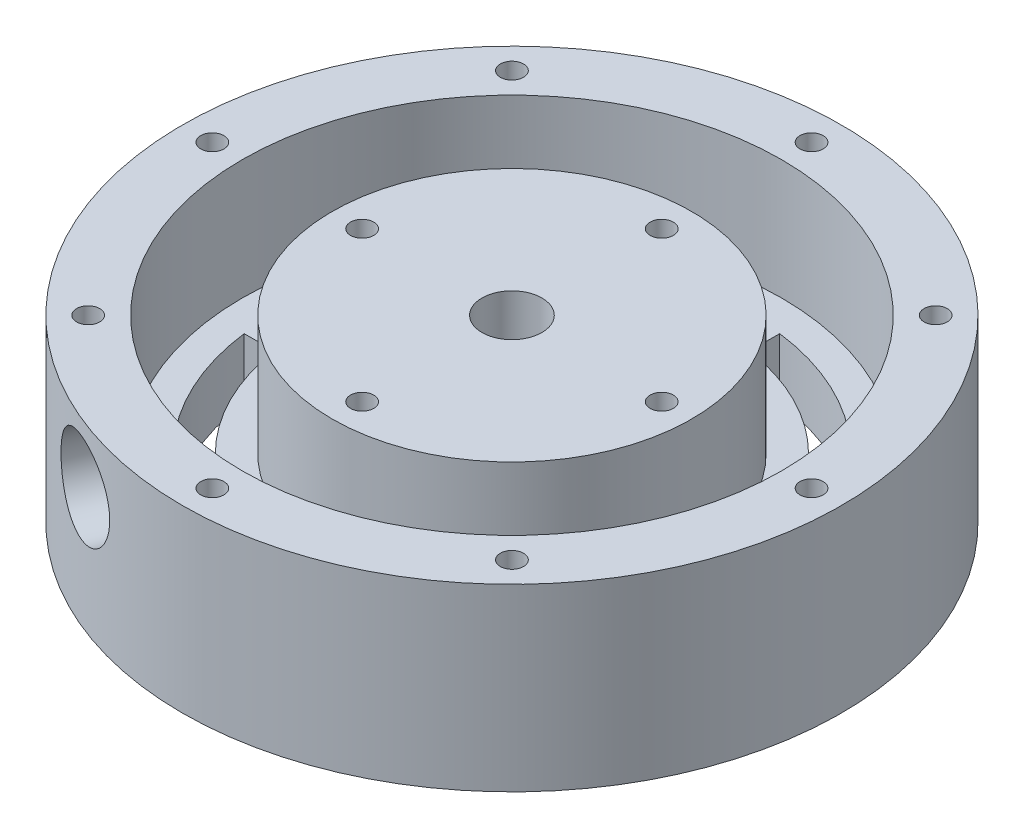
from build123d import *

# Parameters (mm, degrees)
SKETCH2_R                    = 69.85
SKETCH2_R_2                  = 57.15
BOSS_EXTRUDE2_DEPTH          = 25.4
SKETCH2_R_3                  = 38.1
SKETCH2_R_4                  = 6.35
BOSS_EXTRUDE2_2_DEPTH        = 25.4
BOSS_EXTRUDE3_START          = -12.7
SKETCH2_5_R                  = 69.85
SKETCH2_5_R_2                = 6.35
BOSS_EXTRUDE3_DEPTH          = 12.7
F_10_0_1935_DIAMETER_HOLE1_D = 4.9149
CIRPATTERN1_COUNT            = 8
F_10_0_1935_DIAMETER_HOLE2_D = 4.9149
CIRPATTERN2_COUNT            = 4
CUT_EXTRUDE1_REACH           = 169.427
SKETCH6_R                    = 9.525


with BuildPart() as part:
    # Sketch2 → Boss-Extrude2 (new body)
    with BuildSketch(Plane(origin=(0, 0, 0), x_dir=(1, 0, 0), z_dir=(0, 1, 0))):
        Circle(SKETCH2_R)
        Circle(SKETCH2_R_2, mode=Mode.SUBTRACT)
    extrude(amount=BOSS_EXTRUDE2_DEPTH)



with BuildPart() as body_2:
    # Sketch2 → Boss-Extrude2 2 (new body)
    with BuildSketch(Plane(origin=(0, 0, 0), x_dir=(1, 0, 0), z_dir=(0, 1, 0))):
        Circle(SKETCH2_R_3)
        Circle(SKETCH2_R_4, mode=Mode.SUBTRACT)
    extrude(amount=BOSS_EXTRUDE2_2_DEPTH)


with BuildPart() as part_1:
    add(part.part)

    add(body_2.part)  # Boss-Extrude3 merges body 2
    # Sketch2<5> → Boss-Extrude3 (add)
    with BuildSketch(Plane(origin=(0, 0, 0), x_dir=(1, 0, 0), z_dir=(0, 1, 0)).offset(BOSS_EXTRUDE3_START)):
        Circle(SKETCH2_5_R)
        with BuildLine():
            Line((-50.401562476, -6.35), (-43.994090512, -6.35))
            ThreePointArc((-43.994090512, -6.35), (-31.430896424, -31.430896424), (-6.35, -43.994090512))
            Line((-6.35, -43.994090512), (-6.35, -50.401562476))
            ThreePointArc((-6.35, -50.401562476), (-35.921024484, -35.921024484), (-50.401562476, -6.35))
        make_face(mode=Mode.SUBTRACT)
        with BuildLine():
            Line((6.35, -50.401562476), (6.35, -43.994090512))
            ThreePointArc((6.35, -43.994090512), (31.430896424, -31.430896424), (43.994090512, -6.35))
            Line((43.994090512, -6.35), (50.401562476, -6.35))
            ThreePointArc((50.401562476, -6.35), (35.921024484, -35.921024484), (6.35, -50.401562476))
        make_face(mode=Mode.SUBTRACT)
        with BuildLine():
            Line((-6.35, 50.401562476), (-6.35, 43.994090512))
            ThreePointArc((-6.35, 43.994090512), (-31.430896424, 31.430896424), (-43.994090512, 6.35))
            Line((-43.994090512, 6.35), (-50.401562476, 6.35))
            ThreePointArc((-50.401562476, 6.35), (-35.921024484, 35.921024484), (-6.35, 50.401562476))
        make_face(mode=Mode.SUBTRACT)
        with BuildLine():
            Line((50.401562476, 6.35), (43.994090512, 6.35))
            ThreePointArc((43.994090512, 6.35), (31.430896424, 31.430896424), (6.35, 43.994090512))
            Line((6.35, 43.994090512), (6.35, 50.401562476))
            ThreePointArc((6.35, 50.401562476), (35.921024484, 35.921024484), (50.401562476, 6.35))
        make_face(mode=Mode.SUBTRACT)
        Circle(SKETCH2_5_R_2, mode=Mode.SUBTRACT)
    extrude(amount=BOSS_EXTRUDE3_DEPTH)

    # #10 (0.1935) Diameter Hole1 (through all)
    with Locations(Plane(origin=(0, 25.4, 0), x_dir=(1, 0, 0), z_dir=(0, 1, 0))):
        with Locations((0, -63.5)):
            f_10_0_1935_diameter_hole1 = Hole(F_10_0_1935_DIAMETER_HOLE1_D / 2)

    # CirPattern1: #10 (0.1935) Diameter Hole1 ×8 about axis
    cirpattern1_axis = Axis((0, -12.7, 0), (0, 1, 0))
    for i in range(1, CIRPATTERN1_COUNT):
        add(f_10_0_1935_diameter_hole1.rotate(cirpattern1_axis, i * 360 / CIRPATTERN1_COUNT), mode=Mode.SUBTRACT)

    # #10 (0.1935) Diameter Hole2 (through all)
    with Locations(Plane(origin=(0, -12.7, 31.75), x_dir=(0, 0, -1), z_dir=(0, -1, 0))):
        with Locations((0, 0)):
            f_10_0_1935_diameter_hole2 = Hole(F_10_0_1935_DIAMETER_HOLE2_D / 2)

    # CirPattern2: #10 (0.1935) Diameter Hole2 ×4 about axis
    cirpattern2_axis = Axis((0, -12.7, 0), (0, 1, 0))
    for i in range(1, CIRPATTERN2_COUNT):
        add(f_10_0_1935_diameter_hole2.rotate(cirpattern2_axis, i * 360 / CIRPATTERN2_COUNT), mode=Mode.SUBTRACT)

    # Sketch6 → Cut-Extrude1 (cut, up to next)
    with BuildSketch(Plane(origin=(-26.730437751, 0, 64.532985346), x_dir=(0, 1, 0), z_dir=(-0.3826834323650906, 0, 0.9238795325112865)), mode=Mode.PRIVATE) as cut_extrude1_sk1:
        with Locations((12.7, 0)):
            Circle(SKETCH6_R)
    cut_extrude1_tool1 = extrude(cut_extrude1_sk1.sketch, amount=-CUT_EXTRUDE1_REACH, mode=Mode.PRIVATE) & part_1.part
    add(cut_extrude1_tool1.solids().sort_by_distance((-26.730438, 12.7, 64.532985))[0], mode=Mode.SUBTRACT)


solid = part_1.part
